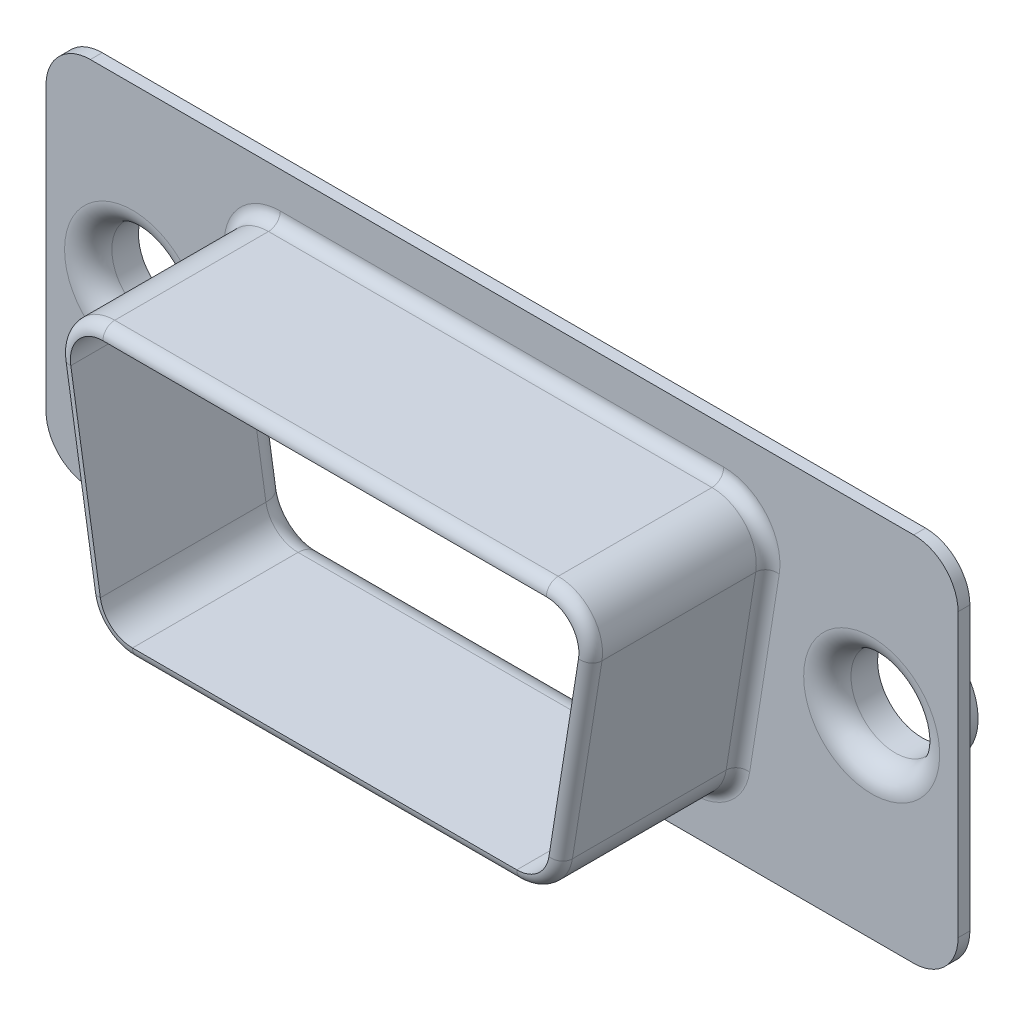
from build123d import *

# Parameters (mm, degrees)
BASE_FLANGE1_DEPTH  = 0.4
SKETCH6_R           = 1.5
CUT_EXTRUDE1_DEPTH  = 10
CUT_EXTRUDE2_DEPTH  = 10
BOSS_EXTRUDE1_START = 6
BOSS_EXTRUDE1_DEPTH = 6
FILLET1_R           = 0.4
FILLET2_R           = 0.8
SKETCH10_R          = 1.9
SKETCH10_R_2        = 1.5
BOSS_EXTRUDE2_DEPTH = 1.3
FILLET3_R           = 0.4
FILLET4_R           = 0.8
FILLET5_R           = 0.4


# Sheet-metal steps are written as plain solids
with BuildPart() as part:
    # Sketch1 → Base-Flange1 (new body)
    with BuildSketch(Plane.XY):
        with BuildLine():
            Line((13.925, 6.275), (-13.925, 6.275))
            ThreePointArc((-13.925, 6.275), (-14.985660172, 5.835660172), (-15.425, 4.775))
            Line((-15.425, 4.775), (-15.425, -4.775))
            ThreePointArc((-15.425, -4.775), (-14.985660172, -5.835660172), (-13.925, -6.275))
            Line((-13.925, -6.275), (13.925, -6.275))
            ThreePointArc((13.925, -6.275), (14.985660172, -5.835660172), (15.425, -4.775))
            Line((15.425, -4.775), (15.425, 4.775))
            ThreePointArc((15.425, 4.775), (14.985660172, 5.835660172), (13.925, 6.275))
        make_face()
    extrude(amount=-BASE_FLANGE1_DEPTH)

    # Sketch6 → Cut-Extrude1 (cut)
    with BuildSketch(Plane.XY):
        with Locations((-12.496974634, 0.275)):
            Circle(SKETCH6_R)
        with Locations((12.503025366, 0.275)):
            Circle(SKETCH6_R)
    extrude(amount=-CUT_EXTRUDE1_DEPTH, mode=Mode.SUBTRACT)

    # Sketch7 → Cut-Extrude2 (cut)
    with BuildSketch(Plane.XY):
        with BuildLine():
            Line((8.586399081, 2.977555701), (7.586399081, -3.322444299))
            ThreePointArc((7.586399081, -3.322444299), (7.214251801, -3.986567011), (6.5, -4.25))
            Line((6.5, -4.25), (-6.5, -4.25))
            ThreePointArc((-6.5, -4.25), (-7.214251801, -3.986567011), (-7.586399081, -3.322444299))
            Line((-7.586399081, -3.322444299), (-8.586399081, 2.977555701))
            ThreePointArc((-8.586399081, 2.977555701), (-8.336567011, 3.864251801), (-7.5, 4.25))
            Line((-7.5, 4.25), (7.5, 4.25))
            ThreePointArc((7.5, 4.25), (8.336567011, 3.864251801), (8.586399081, 2.977555701))
        make_face()
    extrude(amount=-CUT_EXTRUDE2_DEPTH, mode=Mode.SUBTRACT)

    # Sketch8 → Boss-Extrude1 (add)
    with BuildSketch(Plane.XY.offset(BOSS_EXTRUDE1_START)):
        with BuildLine():
            Line((7.5, 4.65), (-7.5, 4.65))
            ThreePointArc((-7.5, 4.65), (-8.640773197, 4.123979729), (-8.981453293, 2.914848684))
            Line((-8.981453293, 2.914848684), (-7.981453293, -3.385151316))
            ThreePointArc((-7.981453293, -3.385151316), (-7.473979729, -4.290773197), (-6.5, -4.65))
            Line((-6.5, -4.65), (6.5, -4.65))
            ThreePointArc((6.5, -4.65), (7.473979729, -4.290773197), (7.981453293, -3.385151316))
            Line((7.981453293, -3.385151316), (8.981453293, 2.914848684))
            ThreePointArc((8.981453293, 2.914848684), (8.640773197, 4.123979729), (7.5, 4.65))
        make_face()
        with BuildLine():
            Line((7.586399081, -3.322444299), (8.586399081, 2.977555701))
            ThreePointArc((8.586399081, 2.977555701), (8.336567011, 3.864251801), (7.5, 4.25))
            Line((7.5, 4.25), (-7.5, 4.25))
            ThreePointArc((-7.5, 4.25), (-8.336567011, 3.864251801), (-8.586399081, 2.977555701))
            Line((-8.586399081, 2.977555701), (-7.586399081, -3.322444299))
            ThreePointArc((-7.586399081, -3.322444299), (-7.214251801, -3.986567011), (-6.5, -4.25))
            Line((-6.5, -4.25), (6.5, -4.25))
            ThreePointArc((6.5, -4.25), (7.214251801, -3.986567011), (7.586399081, -3.322444299))
        make_face(mode=Mode.SUBTRACT)
    extrude(amount=-BOSS_EXTRUDE1_DEPTH)

    # Fillet1
    fillet1_edges = [part.edges().sort_by_distance(p)[0] for p in [
        (-7.473979729, -4.290773197, 0),
        (0, -4.65, 0),
        (7.473979729, -4.290773197, 0),
        (8.481453293, -0.235151316, 0),
        (8.640773197, 4.123979729, 0),
        (0, 4.65, 0),
        (-8.640773197, 4.123979729, 0),
        (-8.481453293, -0.235151316, 0),
    ]]
    fillet(fillet1_edges, radius=FILLET1_R)

    # Fillet2
    fillet2_edges = [part.edges().sort_by_distance(p)[0] for p in [
        (8.336567011, 3.864251801, -0.4),
        (8.086399081, -0.172444299, -0.4),
        (7.214251801, -3.986567011, -0.4),
        (0, -4.25, -0.4),
        (-7.214251801, -3.986567011, -0.4),
        (-8.086399081, -0.172444299, -0.4),
        (-8.336567011, 3.864251801, -0.4),
        (0, 4.25, -0.4),
    ]]
    fillet(fillet2_edges, radius=FILLET2_R)

    # Sketch10 → Boss-Extrude2 (add)
    # profile 1 of 2: a face of its own
    with BuildSketch(Plane(origin=(0, 0, -0.4), x_dir=(-1, 0, 0), z_dir=(0, 0, -1))):
        with Locations((-12.503025366, 0.275)):
            Circle(SKETCH10_R)
        with Locations(Location((-12.503025366, 0.275, 0), (0, 0, 180))):
            Circle(SKETCH10_R_2, mode=Mode.SUBTRACT)
    # profile 2 of 2: a face of its own
    with BuildSketch(Plane(origin=(0, 0, -0.4), x_dir=(-1, 0, 0), z_dir=(0, 0, -1))):
        with Locations((12.496974634, 0.275)):
            Circle(SKETCH10_R)
        with Locations(Location((12.496974634, 0.275, 0), (0, 0, 180))):
            Circle(SKETCH10_R_2, mode=Mode.SUBTRACT)
    extrude(amount=BOSS_EXTRUDE2_DEPTH)

    # Fillet3
    fillet3_edges = [part.edges().sort_by_distance(p)[0] for p in [
        (14.403025366, 0.275, -0.4),
        (-10.596974634, 0.275, -0.4),
    ]]
    fillet(fillet3_edges, radius=FILLET3_R)

    # Fillet4
    fillet4_edges = [part.edges().sort_by_distance(p)[0] for p in [
        (-13.996974634, 0.275, 0),
        (11.003025366, 0.275, 0),
    ]]
    fillet(fillet4_edges, radius=FILLET4_R)

    # Fillet5
    fillet5_edges = [part.edges().sort_by_distance(p)[0] for p in [
        (8.640773197, 4.123979729, 6),
        (0, 4.65, 6),
        (-8.640773197, 4.123979729, 6),
        (-8.481453293, -0.235151316, 6),
        (-7.473979729, -4.290773197, 6),
        (0, -4.65, 6),
        (7.473979729, -4.290773197, 6),
        (8.481453293, -0.235151316, 6),
    ]]
    fillet(fillet5_edges, radius=FILLET5_R - 0.0001)  # a hair under: the kernel refuses the full size


solid = part.part
